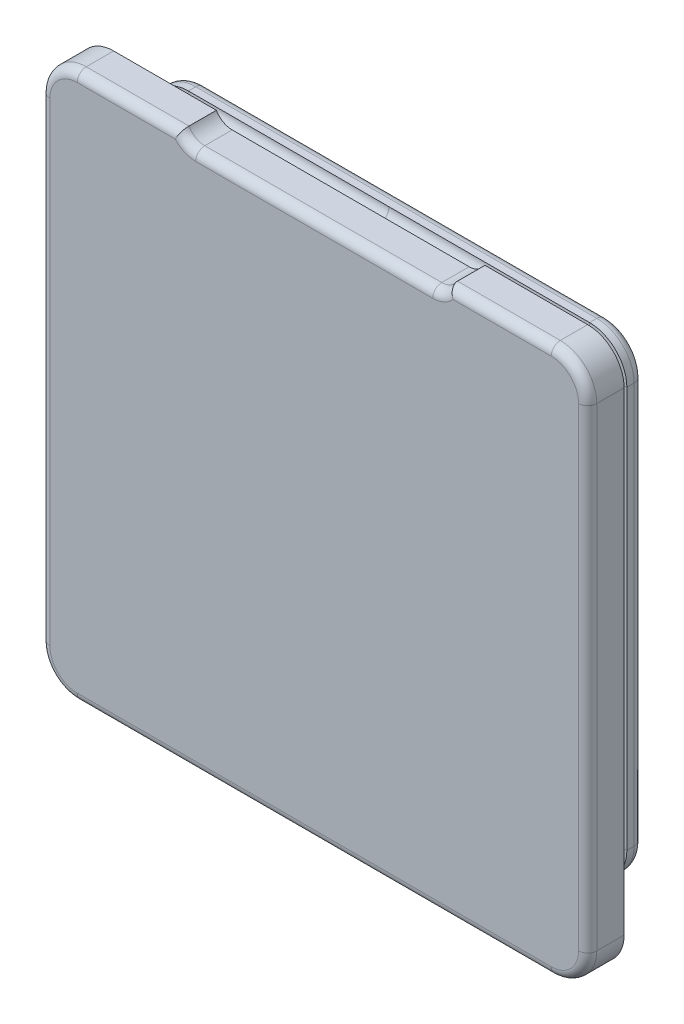
from build123d import *

# Parameters (mm, degrees)
BOSS_EXTRUDE1_DEPTH = 2
BOSS_EXTRUDE2_DEPTH = 5
SKETCH6_W           = 20.1
SKETCH6_H           = 20.1
CUT_EXTRUDE1_DEPTH  = 3
SKETCH5_R           = 0.6
FILLET1_R           = 0.5


with BuildPart() as part:
    # Sketch2 → Boss-Extrude1 (new body)
    with BuildSketch(Plane.XY):
        with BuildLine():
            ThreePointArc((-60.960758129, 127.051811933), (-61.460758129, 127.185786529), (-61.826783532, 127.551811933))
            Line((-61.826783532, 127.551811933), (-67.460758129, 127.551811933))
            ThreePointArc((-67.460758129, 127.551811933), (-68.874971691, 126.966025495), (-69.460758129, 125.551811933))
            Line((-69.460758129, 125.551811933), (-69.460758129, 99.551811933))
            ThreePointArc((-69.460758129, 99.551811933), (-68.874971691, 98.13759837), (-67.460758129, 97.551811933))
            Line((-67.460758129, 97.551811933), (-41.460758129, 97.551811933))
            ThreePointArc((-41.460758129, 97.551811933), (-40.046544566, 98.13759837), (-39.460758129, 99.551811933))
            Line((-39.460758129, 99.551811933), (-39.460758129, 125.551811933))
            ThreePointArc((-39.460758129, 125.551811933), (-40.046544566, 126.966025495), (-41.460758129, 127.551811933))
            Line((-41.460758129, 127.551811933), (-47.094732725, 127.551811933))
            ThreePointArc((-47.094732725, 127.551811933), (-47.460758129, 127.185786529), (-47.960758129, 127.051811933))
            Line((-47.960758129, 127.051811933), (-60.960758129, 127.051811933))
        make_face()
    extrude(amount=-BOSS_EXTRUDE1_DEPTH)

    # Sketch2<2> → Boss-Extrude2 (add)
    with BuildSketch(Plane.XY):
        with BuildLine():
            Line((-65.460758129, 99.501811933), (-43.460758129, 99.501811933))
            ThreePointArc((-43.460758129, 99.501811933), (-42.011189227, 100.102243031), (-41.410758129, 101.551811933))
            Line((-41.410758129, 101.551811933), (-41.410758129, 123.551811933))
            ThreePointArc((-41.410758129, 123.551811933), (-42.011189227, 125.001380834), (-43.460758129, 125.601811933))
            Line((-43.460758129, 125.601811933), (-65.460758129, 125.601811933))
            ThreePointArc((-65.460758129, 125.601811933), (-66.91032703, 125.001380834), (-67.510758129, 123.551811933))
            Line((-67.510758129, 123.551811933), (-67.510758129, 101.551811933))
            ThreePointArc((-67.510758129, 101.551811933), (-66.91032703, 100.102243031), (-65.460758129, 99.501811933))
        make_face()
    extrude(amount=-BOSS_EXTRUDE2_DEPTH)

    # Sketch6 → Cut-Extrude1 (cut)
    with BuildSketch(Plane(origin=(0, 0, -5), x_dir=(-1, 0, 0), z_dir=(0, 0, -1))):
        with Locations((54.460758129, 112.551811933)):
            Rectangle(SKETCH6_W, SKETCH6_H)
    extrude(amount=-CUT_EXTRUDE1_DEPTH, mode=Mode.SUBTRACT)

    # Cut-Sweep1: sweep along a path in Sketch4
    with BuildLine(Plane.XY.offset(-3.5)) as cut_sweep1_path:
        Line((-41.410758129, 101.551811933), (-41.410758129, 123.551811933))
        ThreePointArc((-41.410758129, 123.551811933), (-42.011189227, 125.001380834), (-43.460758129, 125.601811933))
        Line((-43.460758129, 125.601811933), (-65.460758129, 125.601811933))
        ThreePointArc((-65.460758129, 125.601811933), (-66.91032703, 125.001380834), (-67.510758129, 123.551811933))
        Line((-67.510758129, 123.551811933), (-67.510758129, 101.551811933))
        ThreePointArc((-67.510758129, 101.551811933), (-66.91032703, 100.102243031), (-65.460758129, 99.501811933))
        Line((-65.460758129, 99.501811933), (-43.460758129, 99.501811933))
        ThreePointArc((-43.460758129, 99.501811933), (-42.011189227, 100.102243031), (-41.410758129, 101.551811933))
    # Sketch5 → Cut-Sweep1 (sweep, cut)
    with BuildSketch(Plane(origin=(-54.460758129, 0, 0), x_dir=(0, 0, -1), z_dir=(1, 0, 0))):
        with Locations((3.5, 125.601811933)):
            Circle(SKETCH5_R)
    sweep(path=cut_sweep1_path.line, mode=Mode.SUBTRACT)

    # Fillet1
    fillet1_edges = [part.edges().sort_by_distance(p)[0] for p in [
        (-44.277745427, 127.551811933, 0),
        (-40.046544566, 126.966025495, 0),
        (-39.460758129, 112.551811933, 0),
        (-40.046544566, 98.13759837, 0),
        (-54.460758129, 97.551811933, 0),
        (-68.874971691, 98.13759837, 0),
        (-69.460758129, 112.551811933, 0),
        (-68.874971691, 126.966025495, 0),
        (-64.64377083, 127.551811933, 0),
        (-61.460758129, 127.185786529, 0),
        (-54.460758129, 127.051811933, 0),
        (-47.460758129, 127.185786529, 0),
        (-64.510758129, 112.551811933, -2),
        (-54.460758129, 102.501811933, -2),
        (-44.410758129, 112.551811933, -2),
        (-54.460758129, 122.601811933, -2),
        (-42.011189227, 125.001380834, -5),
        (-54.460758129, 125.601811933, -5),
        (-66.91032703, 125.001380834, -5),
        (-67.510758129, 112.551811933, -5),
        (-66.91032703, 100.102243031, -5),
        (-54.460758129, 99.501811933, -5),
        (-42.011189227, 100.102243031, -5),
        (-41.410758129, 112.551811933, -5),
        (-64.510758129, 112.551811933, -5),
        (-54.460758129, 122.601811933, -5),
        (-44.410758129, 112.551811933, -5),
        (-54.460758129, 102.501811933, -5),
    ]]
    fillet(fillet1_edges, radius=FILLET1_R - 0.0001)  # a hair under: the kernel refuses the full size


solid = part.part
